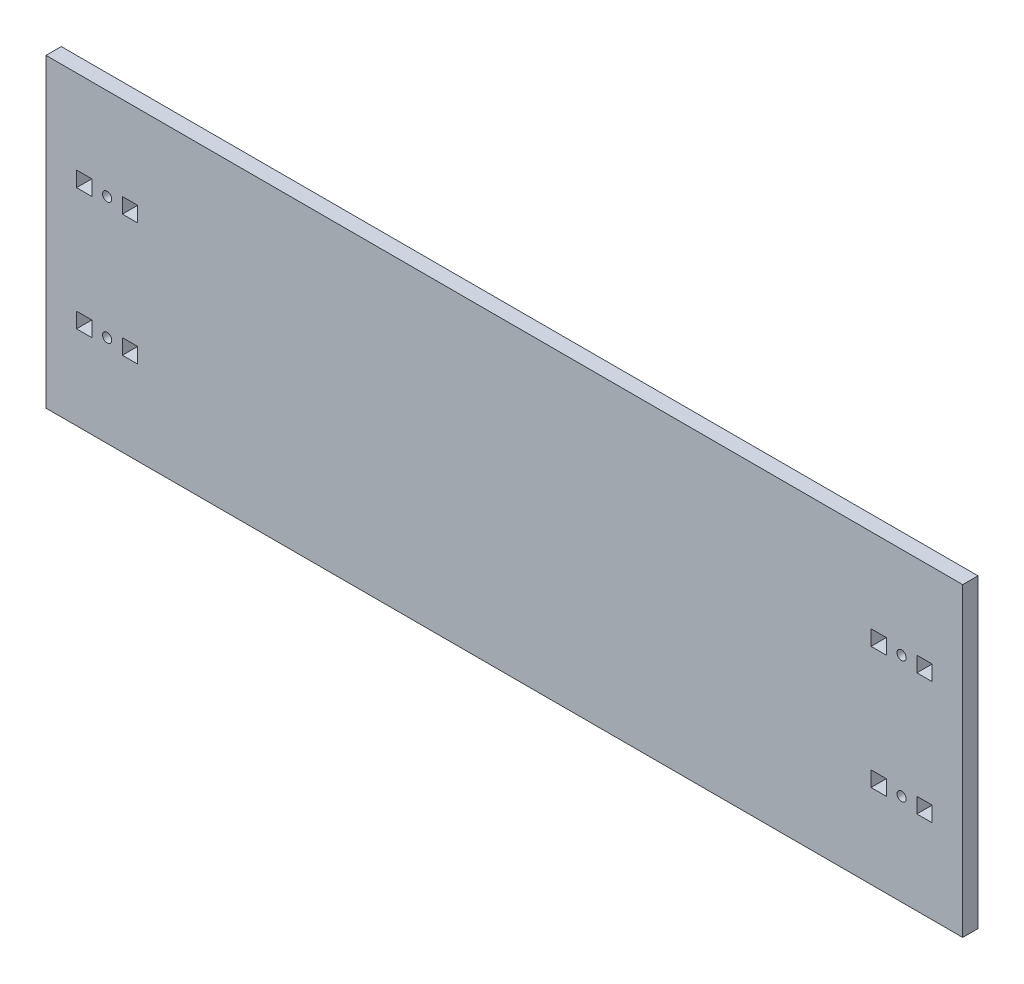
from build123d import *

# Parameters (mm, degrees)
SKETCH2_W           = 300
SKETCH2_H           = 100
SKETCH2_R           = 1.5
SKETCH2_W_2         = 5
SKETCH2_H_2         = 5
BOSS_EXTRUDE1_DEPTH = 5


with BuildPart() as part:
    # Sketch2 → Boss-Extrude1 (new body)
    with BuildSketch(Plane.XY):
        with Locations((150, 50)):
            Rectangle(SKETCH2_W, SKETCH2_H)
        with Locations((20, 70)):
            Circle(SKETCH2_R, mode=Mode.SUBTRACT)
        with Locations((280, 30)):
            Circle(SKETCH2_R, mode=Mode.SUBTRACT)
        with Locations((20, 30)):
            Circle(SKETCH2_R, mode=Mode.SUBTRACT)
        with Locations((280, 70)):
            Circle(SKETCH2_R, mode=Mode.SUBTRACT)
        with Locations((12.5, 70)):
            Rectangle(SKETCH2_W_2, SKETCH2_H_2, mode=Mode.SUBTRACT)
        with Locations((27.5, 70)):
            Rectangle(SKETCH2_W_2, SKETCH2_H_2, mode=Mode.SUBTRACT)
        with Locations((272.5, 30)):
            Rectangle(SKETCH2_W_2, SKETCH2_H_2, mode=Mode.SUBTRACT)
        with Locations((287.5, 30)):
            Rectangle(SKETCH2_W_2, SKETCH2_H_2, mode=Mode.SUBTRACT)
        with Locations((12.5, 30)):
            Rectangle(SKETCH2_W_2, SKETCH2_H_2, mode=Mode.SUBTRACT)
        with Locations((27.5, 30)):
            Rectangle(SKETCH2_W_2, SKETCH2_H_2, mode=Mode.SUBTRACT)
        with Locations((272.5, 70)):
            Rectangle(SKETCH2_W_2, SKETCH2_H_2, mode=Mode.SUBTRACT)
        with Locations((287.5, 70)):
            Rectangle(SKETCH2_W_2, SKETCH2_H_2, mode=Mode.SUBTRACT)
    extrude(amount=BOSS_EXTRUDE1_DEPTH)


solid = part.part
